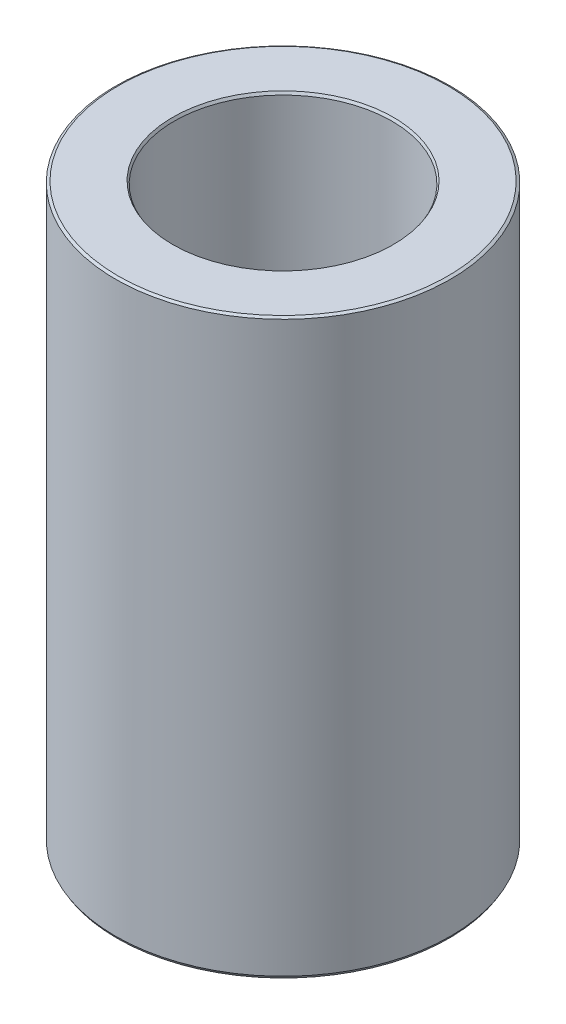
from build123d import *
from OCP.BRepFilletAPI import BRepFilletAPI_MakeChamfer

# Parameters (mm, degrees)
SKETCH1_R           = 50
BOSS_EXTRUDE1_DEPTH = 171.133712257
SKETCH2_R           = 32.502347416
CUT_EXTRUDE1_DEPTH  = 186.166809852
CHAMFER1_SIZE       = 0.447021919
CHAMFER1_SIZE2      = 0.774264676


with BuildPart() as part:
    # Sketch1 → Boss-Extrude1 (new body)
    with BuildSketch(Plane(origin=(0, 0, 0), x_dir=(1, 0, 0), z_dir=(0, 1, 0))):
        Circle(SKETCH1_R)
    extrude(amount=BOSS_EXTRUDE1_DEPTH)

    # Sketch2 → Cut-Extrude1 (cut, through all)
    with BuildSketch(Plane(origin=(0, 0, 0), x_dir=(1, 0, 0), z_dir=(0, 1, 0))):
        Circle(SKETCH2_R)
    extrude(amount=CUT_EXTRUDE1_DEPTH, mode=Mode.SUBTRACT)

    # Chamfer1: one chamfer whose edges measure the first distance from different faces: ONE call of the kernel's chamfer builder (chamfer() names one face for all edges)
    chamfer1_edges_1 = [part.edges().sort_by_distance(p)[0] for p in [
        (-32.502347416, 171.133712257, 0),
    ]]
    chamfer1_side_1 = [part.faces().sort_by_distance(p)[0] for p in [
        (-48.585786438, 171.133712257, 0),
    ]]
    chamfer1_edges_2 = [part.edges().sort_by_distance(p)[0] for p in [
        (-32.502347416, 0, 0),
    ]]
    chamfer1_side_2 = [part.faces().sort_by_distance(p)[0] for p in [
        (-32.502347416, 85.566856128, 0),
    ]]
    chamfer1_edges_3 = [part.edges().sort_by_distance(p)[0] for p in [
        (-50, 0, 0),
    ]]
    chamfer1_side_3 = [part.faces().sort_by_distance(p)[0] for p in [
        (-48.585786438, 0, 0),
    ]]
    chamfer1_edges_4 = [part.edges().sort_by_distance(p)[0] for p in [
        (-50, 171.133712257, 0),
    ]]
    chamfer1_side_4 = [part.faces().sort_by_distance(p)[0] for p in [
        (-50, 85.566856128, 0),
    ]]
    chamfer1 = BRepFilletAPI_MakeChamfer(part.part.solid().wrapped)
    for e in chamfer1_edges_1:
        chamfer1.Add(CHAMFER1_SIZE, CHAMFER1_SIZE2, e.wrapped, chamfer1_side_1[0].wrapped)  # the first distance lies on this face
    for e in chamfer1_edges_2:
        chamfer1.Add(CHAMFER1_SIZE, CHAMFER1_SIZE2, e.wrapped, chamfer1_side_2[0].wrapped)  # the first distance lies on this face
    for e in chamfer1_edges_3:
        chamfer1.Add(CHAMFER1_SIZE, CHAMFER1_SIZE2, e.wrapped, chamfer1_side_3[0].wrapped)  # the first distance lies on this face
    for e in chamfer1_edges_4:
        chamfer1.Add(CHAMFER1_SIZE, CHAMFER1_SIZE2, e.wrapped, chamfer1_side_4[0].wrapped)  # the first distance lies on this face
    add(Compound.cast(chamfer1.Shape()), mode=Mode.REPLACE)


solid = part.part
